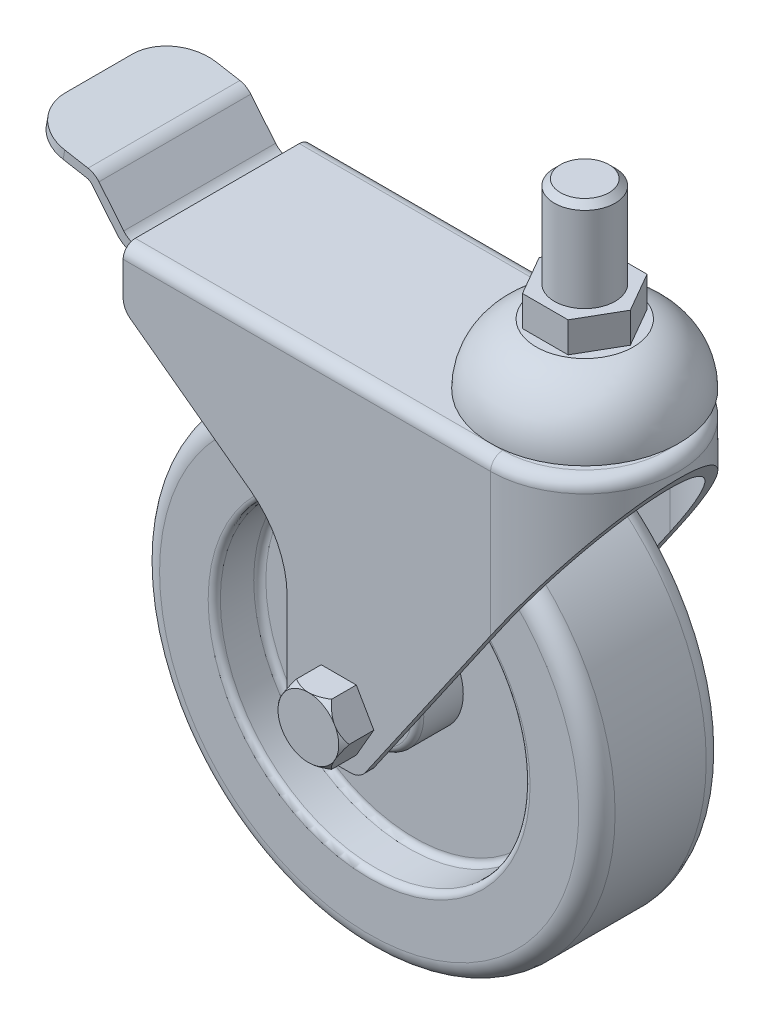
from build123d import *

# Parameters (mm, degrees)
FILLET1_R                = 3
FILLET2_R                = 1
FILLET4_R                = 1
BOSS_EXTRUDE1_DEPTH      = 48.5
BOSS_EXTRUDE1_DEPTH_BACK = 8
SKETCH3_W                = 33.5
SKETCH3_H                = 31
CUT_EXTRUDE1_DEPTH       = 33
FILLET5_R                = 2
SHELL2_START             = -8
SHELL2_DEPTH             = 54.5
SHELL2_START_2           = 45.5
SHELL2_2_OUTLINE_R       = 11
SHELL2_2_DEPTH           = 6.5
SHELL2_START_3           = -9
SHELL2_3_DEPTH           = 34
FILLET7_R                = 3
SKETCH8_R                = 3
CUT_EXTRUDE3_DEPTH       = 80.129640631
SKETCH10_R               = 3
BOSS_EXTRUDE2_DEPTH      = 40
BOSS_EXTRUDE3_DEPTH      = 5
BOSS_EXTRUDE4_DEPTH      = 5
CHAMFER1_SIZE            = 0.5
BOSS_EXTRUDE5_DEPTH      = 5
SKETCH15_R               = 5
BOSS_EXTRUDE6_DEPTH      = 15
CHAMFER2_SIZE            = 1
BOSS_EXTRUDE7_DEPTH      = 27
FILLET8_R                = 15
CUT_EXTRUDE4_DEPTH       = 99.592596112
FILLET9_R                = 3
BOSS_EXTRUDE8_DEPTH      = 12.5
FILLET10_R               = 7
ESCALA1_SCALE            = 1.3


with BuildPart() as part:
    # Sketch1 → Revolve1 (revolve)
    with BuildSketch(Plane(origin=(0, 0, 0), x_dir=(1, 0, 0), z_dir=(0, 1, 0)), mode=Mode.PRIVATE) as revolve1_sk:
        Polygon((-37.5, 10.5), (-37.5, -10.5), (-25.5, -10.5), (-25.5, -3), (-8, -3), (-8, -10.5), (-3, -10.5), (-3, 10.5), (-8, 10.5), (-8, 3), (-25.5, 3), (-25.5, 10.5), align=None)
    revolve(revolve1_sk.sketch.rotate(Axis((0, 0, 0), (0, 0, -1)), 180), axis=Axis((0, 0, 0), (0, 0, -1)))

    # Fillet1
    fillet1_edges = [part.edges().sort_by_distance(p)[0] for p in [
        (-37.5, 0, 10.5),
        (-37.5, 0, -10.5),
    ]]
    fillet(fillet1_edges, radius=FILLET1_R)

    # Fillet2
    fillet2_edges = [part.edges().sort_by_distance(p)[0] for p in [
        (-8, 0, -10.5),
        (-8, 0, 10.5),
    ]]
    fillet(fillet2_edges, radius=FILLET2_R)

    # Fillet4
    fillet4_edges = [part.edges().sort_by_distance(p)[0] for p in [
        (-25.5, 0, 3),
        (-25.5, 0, 10.5),
        (-25.5, 0, -10.5),
        (-25.5, 0, -3),
    ]]
    fillet(fillet4_edges, radius=FILLET4_R)


with BuildPart() as body_2:
    # Sketch2 → Revolve2 (revolve)
    with BuildSketch(Plane.XY, mode=Mode.PRIVATE) as revolve2_sk:
        with BuildLine():
            Line((25, 60.5), (33, 60.5))
            ThreePointArc((33, 60.5), (38.416666667, 56.75), (40.5, 50.5))
            Line((40.5, 50.5), (37.5, 50.5))
            Line((37.5, 50.5), (37.5, 48.5))
            Line((37.5, 48.5), (40.5, 48.5))
            Line((40.5, 48.5), (40.5, 20.5))
            Line((40.5, 20.5), (25, 20.5))
            Line((25, 20.5), (25, 60.5))
        make_face()
    revolve(revolve2_sk.sketch.rotate(Axis((25, 20.5, 0), (0, 1, 0)), 90), axis=Axis((25, 20.5, 0), (0, 1, 0)))

    # Sketch3 → Boss-Extrude1 (add, two sides: drawn at the far end of the back side and taken through both)
    with BuildSketch(Plane(origin=(0, 0, 0), x_dir=(1, 0, 0), z_dir=(0, 1, 0)).offset(-BOSS_EXTRUDE1_DEPTH_BACK)):
        with Locations((8.25, 0)):
            Rectangle(SKETCH3_W, SKETCH3_H)
    extrude(amount=BOSS_EXTRUDE1_DEPTH + BOSS_EXTRUDE1_DEPTH_BACK)

    # Sketch6 → Cut-Extrude1 (cut, symmetric)
    with BuildSketch(Plane.XY):
        Polygon((3.5, -8), (40.5, 45.5), (40.5, -8), align=None)
    extrude(amount=CUT_EXTRUDE1_DEPTH, both=True, mode=Mode.SUBTRACT)

    # Fillet5
    fillet5_edges = [body_2.edges().sort_by_distance(p)[0] for p in [
        (8.25, 48.5, -15.5),
        (8.25, 48.5, 15.5),
        (40.5, 48.5, 0),
    ]]
    fillet(fillet5_edges, radius=FILLET5_R)

    # Shell2: read off the stored shape, not the designer's step
    # Shell2 outline → Shell2 (cut)
    with BuildSketch(Plane(origin=(0, 0, 0), x_dir=(1, 0, 0), z_dir=(0, 1, 0)).offset(SHELL2_START)):
        with BuildLine():
            ThreePointArc((25, -14), (39, 0), (25, 14))
            Line((25, 14), (-8.5, 14))
            Line((-8.5, 14), (-8.5, -14))
            Line((-8.5, -14), (25, -14))
        make_face()
    extrude(amount=SHELL2_DEPTH, mode=Mode.SUBTRACT)

    # Shell2 2 outline → Shell2 2 (cut)
    with BuildSketch(Plane(origin=(0, 0, 0), x_dir=(1, 0, 0), z_dir=(0, 1, 0)).offset(SHELL2_START_2)):
        with Locations((25, 0)):
            Circle(SHELL2_2_OUTLINE_R)
    extrude(amount=SHELL2_2_DEPTH, mode=Mode.SUBTRACT)

    # Shell2 3 outline → Shell2 3 (cut)
    with BuildSketch(Plane.YZ.offset(SHELL2_START_3)):
        with BuildLine():
            ThreePointArc((46.5, -14), (46.853553391, -13.853553391), (47, -13.5))
            Line((47, -13.5), (47, 13.5))
            ThreePointArc((47, 13.5), (46.853553391, 13.853553391), (46.5, 14))
            Line((46.5, 14), (46.5, -14))
        make_face()
    extrude(amount=SHELL2_3_DEPTH, mode=Mode.SUBTRACT)

    # Shell2 4 outline → Shell2 4 (revolve, cut)
    with BuildSketch(Plane(origin=(25, 0, 0), x_dir=(1, 0, 0), z_dir=(0, 0, 1))):
        with BuildLine():
            Line((7.777204979, 59), (0, 59))
            Line((0, 59), (0, 52))
            Line((0, 52), (13.872926296, 52))
            ThreePointArc((13.872926296, 52), (11.807728462, 56.355719818), (7.777204979, 59))
        make_face()
        with BuildLine():
            Line((13.5, 47), (11, 47))
            Line((11, 47), (11, 46.5))
            Line((11, 46.5), (14, 46.5))
            ThreePointArc((14, 46.5), (13.853553391, 46.853553391), (13.5, 47))
        make_face()
    revolve(axis=Axis((25, 0, 0), (0, 1, 0)), mode=Mode.SUBTRACT)

    # Fillet7
    fillet7_edges = [body_2.edges().sort_by_distance(p)[0] for p in [
        (-8.5, -8, -14.75),
        (3.5, -8, 14.75),
        (3.5, -8, -14.75),
        (-8.5, -8, 14.75),
    ]]
    fillet(fillet7_edges, radius=FILLET7_R)

    # Sketch8 → Cut-Extrude3 (cut, through all)
    with BuildSketch(Plane.XY.offset(15.5)):
        Circle(SKETCH8_R)
    extrude(amount=-CUT_EXTRUDE3_DEPTH, mode=Mode.SUBTRACT)



with BuildPart() as body_3:
    # Sketch10 → Boss-Extrude2 (new body)
    with BuildSketch(Plane.XY.offset(15.5)):
        Circle(SKETCH10_R)
    extrude(amount=-BOSS_EXTRUDE2_DEPTH)

    # Sketch11 → Boss-Extrude3 (add)
    with BuildSketch(Plane.XY.offset(15.5)):
        Polygon((5.773502692, 0), (2.886751346, 5), (-2.886751346, 5), (-5.773502692, 0), (-2.886751346, -5), (2.886751346, -5), align=None)
    extrude(amount=BOSS_EXTRUDE3_DEPTH)


with BuildPart() as body_2_1:
    add(body_2.part)

    add(body_3.part)  # Boss-Extrude4 merges body 3
    # Sketch13 → Boss-Extrude4 (add)
    with BuildSketch(Plane(origin=(0, 0, -15.5), x_dir=(-1, 0, 0), z_dir=(0, 0, -1))):
        Polygon((5.773502692, 0), (2.886751346, 5), (-2.886751346, 5), (-5.773502692, 0), (-2.886751346, -5), (2.886751346, -5), align=None)
    extrude(amount=BOSS_EXTRUDE4_DEPTH)

    # Sketch12 → Cut-Revolve1 (revolve, cut)
    with BuildSketch(Plane(origin=(0, 0, 0), x_dir=(0, 0, -1), z_dir=(1, 0, 0)), mode=Mode.PRIVATE) as cut_revolve1_sk:
        Polygon((-22.835771261, 3.040055196), (-18.164228739, 6.959944804), (-22.835771261, 6.959944804), align=None)
        Polygon((22.835771261, 6.959944804), (22.835771261, 3.040055196), (18.164228739, 6.959944804), align=None)
    revolve(cut_revolve1_sk.sketch.rotate(Axis((0, 0, 0), (0, 0, 1)), 90), axis=Axis((0, 0, 0), (0, 0, 1)), mode=Mode.SUBTRACT)

    # Chamfer1
    chamfer1_edges = [body_2_1.edges().sort_by_distance(p)[0] for p in [
        (-3, 0, -24.5),
    ]]
    chamfer(chamfer1_edges, length=CHAMFER1_SIZE)

    # Sketch14 → Boss-Extrude5 (add)
    with BuildSketch(Plane(origin=(0, 60.5, 0), x_dir=(1, 0, 0), z_dir=(0, 1, 0))):
        Polygon((32.505553499, 0), (28.75277675, 6.5), (21.24722325, 6.5), (17.494446501, 0), (21.24722325, -6.5), (28.75277675, -6.5), align=None)
    extrude(amount=BOSS_EXTRUDE5_DEPTH)

    # Sketch15 → Boss-Extrude6 (add)
    with BuildSketch(Plane(origin=(0, 65.5, 0), x_dir=(1, 0, 0), z_dir=(0, 1, 0))):
        with Locations(Location((25, 0, 0), (0, 0, 270))):
            Circle(SKETCH15_R)
    extrude(amount=BOSS_EXTRUDE6_DEPTH)

    # Chamfer2
    chamfer2_edges = [body_2_1.edges().sort_by_distance(p)[0] for p in [
        (25, 80.5, -5),
    ]]
    chamfer(chamfer2_edges, length=CHAMFER2_SIZE)

    # Sketch17 → Boss-Extrude7 (add)
    with BuildSketch(Plane.ZY.offset(8.5)):
        with BuildLine():
            Line((-15.5, 27), (-14, 27))
            Line((-14, 27), (-14, 46.5))
            ThreePointArc((-14, 46.5), (-13.853553391, 46.853553391), (-13.5, 47))
            Line((-13.5, 47), (13.5, 47))
            ThreePointArc((13.5, 47), (13.853553391, 46.853553391), (14, 46.5))
            Line((14, 46.5), (14, 27))
            Line((14, 27), (15.5, 27))
            Line((15.5, 27), (15.5, 46.5))
            ThreePointArc((15.5, 46.5), (14.914213562, 47.914213562), (13.5, 48.5))
            Line((13.5, 48.5), (-13.5, 48.5))
            ThreePointArc((-13.5, 48.5), (-14.914213562, 47.914213562), (-15.5, 46.5))
            Line((-15.5, 46.5), (-15.5, 27))
        make_face()
    extrude(amount=BOSS_EXTRUDE7_DEPTH)

    # Fillet8
    fillet8_edges = [body_2_1.edges().sort_by_distance(p)[0] for p in [
        (-8.5, 27, -14.75),
        (-8.5, 27, 14.75),
    ]]
    fillet(fillet8_edges, radius=FILLET8_R)

    # Sketch18 → Cut-Extrude4 (cut, through all)
    with BuildSketch(Plane.XY.offset(15.5)):
        Polygon((-14.592420073, 24.06876215), (-35.5, 39.5), (-35.5, 27), align=None)
    extrude(amount=-CUT_EXTRUDE4_DEPTH, mode=Mode.SUBTRACT)

    # Fillet9
    fillet9_edges = [body_2_1.edges().sort_by_distance(p)[0] for p in [
        (-35.5, 39.5, -14.75),
        (-35.5, 39.5, 14.75),
    ]]
    fillet(fillet9_edges, radius=FILLET9_R)


with BuildPart() as body_3_2:
    # Sketch19 → Boss-Extrude8 (new, symmetric)
    with BuildSketch(Plane.XY):
        with BuildLine():
            Line((-21.5, 46.5), (-36.082105835, 46.5))
            ThreePointArc((-36.082105835, 46.5), (-37.364032115, 46.787682723), (-38.4000997, 47.595556659))
            Line((-38.4000997, 47.595556659), (-42.477949566, 52.55891302))
            ThreePointArc((-42.477949566, 52.55891302), (-43.282501241, 53.244738533), (-44.274998898, 53.608892938))
            Line((-44.274998898, 53.608892938), (-55, 55.5))
            Line((-55, 55.5), (-55.260472267, 54.02278837))
            Line((-55.260472267, 54.02278837), (-44.535471165, 52.131681308))
            ThreePointArc((-44.535471165, 52.131681308), (-44.039222336, 51.949604106), (-43.636946499, 51.606691349))
            Line((-43.636946499, 51.606691349), (-39.559096633, 46.643334988))
            ThreePointArc((-39.559096633, 46.643334988), (-38.004995255, 45.431524084), (-36.082105835, 45))
            Line((-36.082105835, 45), (-21.5, 45))
            Line((-21.5, 45), (-21.5, 46.5))
        make_face()
    extrude(amount=BOSS_EXTRUDE8_DEPTH, both=True)

    # Fillet10
    fillet10_edges = [body_3_2.edges().sort_by_distance(p)[0] for p in [
        (-55.130236133, 54.761394185, -12.5),
        (-55.130236133, 54.761394185, 12.5),
    ]]
    fillet(fillet10_edges, radius=FILLET10_R)


with BuildPart() as body_2_2:
    # Escala1: scaled about (0, 0, 0)
    add(body_2_1.part.scale(ESCALA1_SCALE))


with BuildPart() as body_3_2_1:
    # Escala1: scaled about (0, 0, 0)
    add(body_3_2.part.scale(ESCALA1_SCALE))


with BuildPart() as part_1:
    # Escala1: scaled about (0, 0, 0)
    add(part.part.scale(ESCALA1_SCALE))


solid = Compound([body_2_2.part, body_3_2_1.part, part_1.part])
